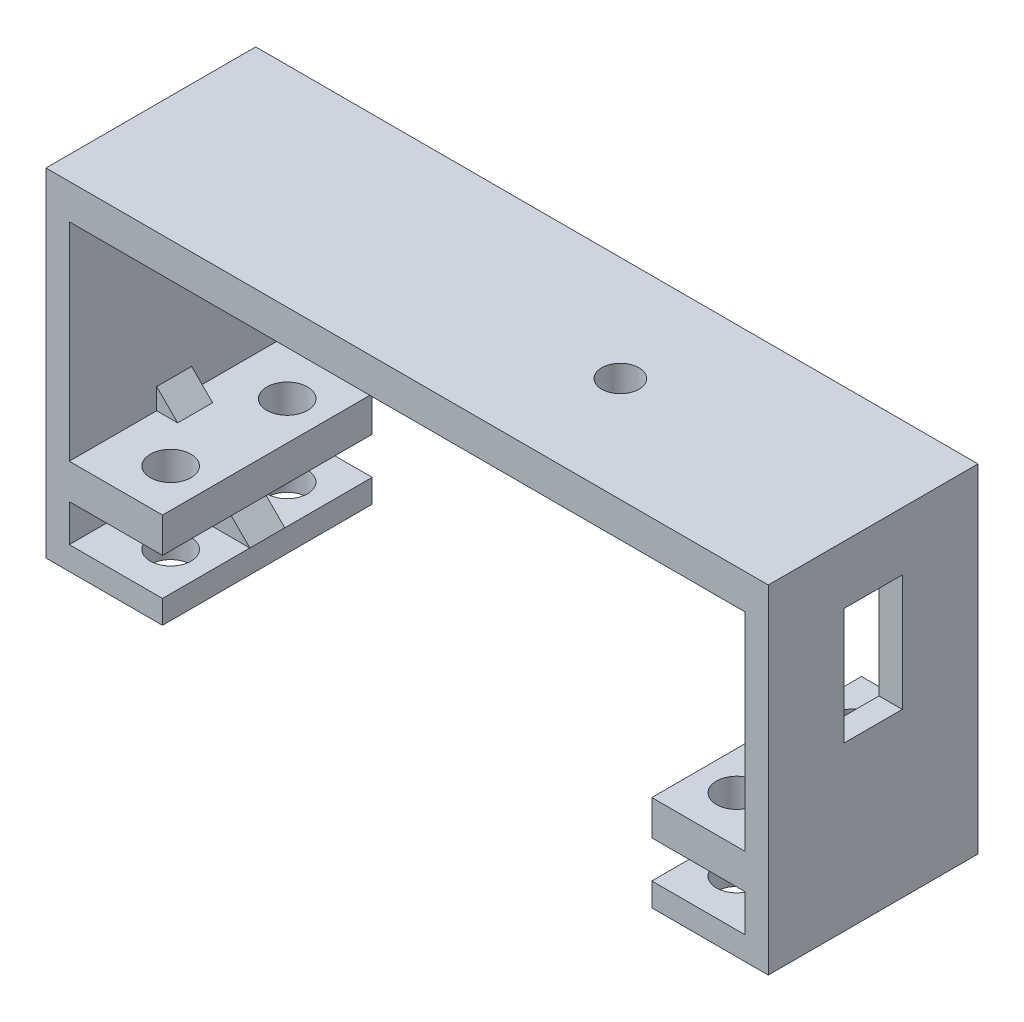
from build123d import *

# Parameters (mm, degrees)
RESSALTO_EXTRUS_O1_DEPTH = 9
ESBO_O2_R                = 1.75
CORTE_EXTRUS_O1_DEPTH    = 16
RESSALTO_EXTRUS_O3_DEPTH = 1.5
ESBO_O6_R                = 1.6
CORTE_EXTRUS_O2_DEPTH    = 3
ESBO_O7_W                = 5
ESBO_O7_H                = 10
CORTE_EXTRUS_O3_DEPTH    = 10
RESSALTO_EXTRUS_O4_START = 3.2
ESBO_O8_W                = 8
ESBO_O8_H                = 18
ESBO_O8_R                = 1.75
RESSALTO_EXTRUS_O4_DEPTH = 3


with BuildPart() as part:
    # Esboço1 → Ressalto-extrusão1 (new, symmetric)
    with BuildSketch(Plane.XY):
        Polygon((-21, 0), (-31, 0), (-31, 29), (31, 29), (31, 0), (21, 0), (21, 2), (29, 2), (29, 26), (-29, 26), (-29, 2), (-21, 2), align=None)
    extrude(amount=RESSALTO_EXTRUS_O1_DEPTH, both=True)

    # Esboço2 → Corte-extrusão1 (cut)
    with BuildSketch(Plane.XZ):
        with Locations((-24.3, -5)):
            Circle(ESBO_O2_R)
        with Locations((-24.3, 5)):
            Circle(ESBO_O2_R)
        with Locations((24.3, 5)):
            Circle(ESBO_O2_R)
        with Locations((24.3, -5)):
            Circle(ESBO_O2_R)
    extrude(amount=-CORTE_EXTRUS_O1_DEPTH, mode=Mode.SUBTRACT)

    # Esboço4 → Ressalto-extrusão3 (add, symmetric)
    with BuildSketch(Plane.XY):
        Polygon((-21, 2), (-29, 10), (-29, 2), align=None)
        Polygon((21, 2), (29, 2), (29, 10), align=None)
    extrude(amount=RESSALTO_EXTRUS_O3_DEPTH, both=True)

    # Esboço6 → Corte-extrusão2 (cut)
    with BuildSketch(Plane(origin=(0, 29, 0), x_dir=(1, 0, 0), z_dir=(0, 1, 0))):
        with Locations((9.3, 0)):
            Circle(ESBO_O6_R)
    extrude(amount=-CORTE_EXTRUS_O2_DEPTH, mode=Mode.SUBTRACT)

    # Esboço7 → Corte-extrusão3 (cut)
    with BuildSketch(Plane(origin=(31, 0, 0), x_dir=(0, 0, -1), z_dir=(1, 0, 0))):
        with Locations((0, 19)):
            Rectangle(ESBO_O7_W, ESBO_O7_H)
    extrude(amount=-CORTE_EXTRUS_O3_DEPTH, mode=Mode.SUBTRACT)

    # Esboço8 → Ressalto-extrusão4 (add)
    # profile 1 of 2: a face of its own
    with BuildSketch(Plane(origin=(0, 2, 0), x_dir=(1, 0, 0), z_dir=(0, 1, 0)).offset(RESSALTO_EXTRUS_O4_START)):
        with Locations((-25, 0)):
            Rectangle(ESBO_O8_W, ESBO_O8_H)
        with Locations((-24.3, -5)):
            Circle(ESBO_O8_R, mode=Mode.SUBTRACT)
        with Locations((-24.3, 5)):
            Circle(ESBO_O8_R, mode=Mode.SUBTRACT)
    # profile 2 of 2: a face of its own
    with BuildSketch(Plane(origin=(0, 2, 0), x_dir=(1, 0, 0), z_dir=(0, 1, 0)).offset(RESSALTO_EXTRUS_O4_START)):
        with Locations((25, 0)):
            Rectangle(ESBO_O8_W, ESBO_O8_H)
        with Locations((24.3, -5)):
            Circle(ESBO_O8_R, mode=Mode.SUBTRACT)
        with Locations((24.3, 5)):
            Circle(ESBO_O8_R, mode=Mode.SUBTRACT)
    extrude(amount=RESSALTO_EXTRUS_O4_DEPTH)


solid = part.part
